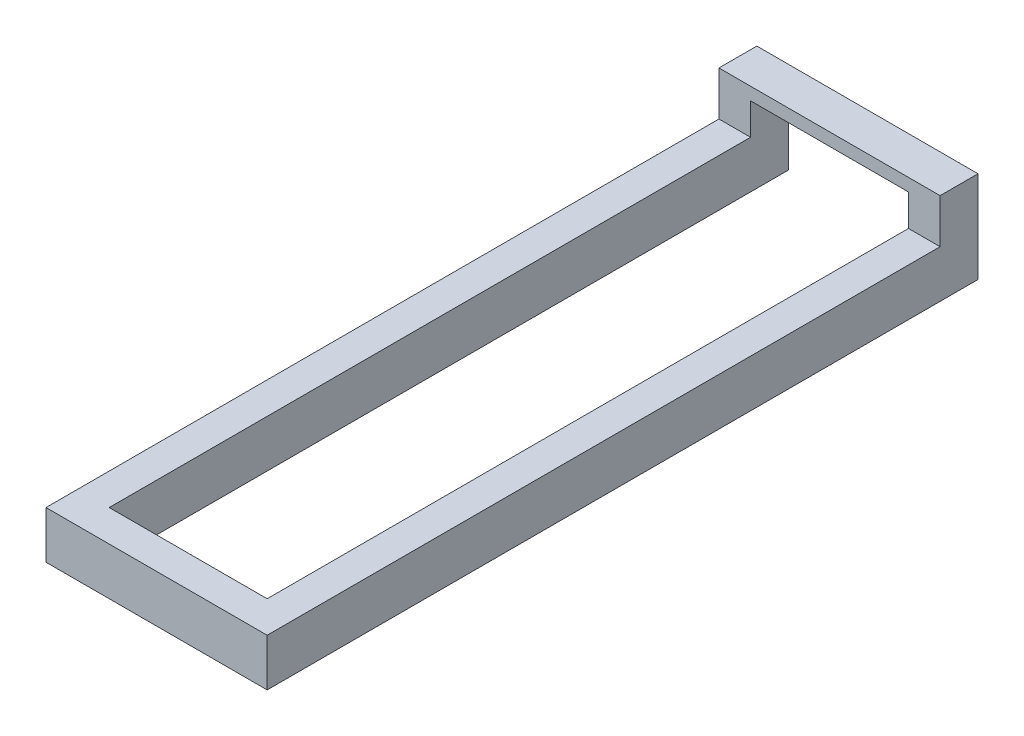
from build123d import *

# Parameters (mm, degrees)
BOSS_EXTRUDE1_DEPTH = 7.5
BOSS_EXTRUDE2_DEPTH = 12


with BuildPart() as part:
    # Sketch1 → Boss-Extrude1 (new, symmetric)
    with BuildSketch(Plane(origin=(0, 0, 0), x_dir=(1, 0, 0), z_dir=(0, 1, 0))):
        Polygon((25, 107.5), (35, 107.5), (35, -117.5), (-35, -117.5), (-35, 107.5), (-25, 107.5), (-25, -107.5), (25, -107.5), align=None)
    extrude(amount=BOSS_EXTRUDE1_DEPTH, both=True)

    # Sketch2 → Boss-Extrude2 (add)
    with BuildSketch(Plane(origin=(0, 0, -107.5), x_dir=(-1, 0, 0), z_dir=(0, 0, -1))):
        Polygon((-35, 7.5), (-25, 7.5), (-25, 17.5), (25, 17.5), (25, 7.5), (35, 7.5), (35, 21.5), (-35, 21.5), align=None)
    extrude(amount=-BOSS_EXTRUDE2_DEPTH)


solid = part.part
